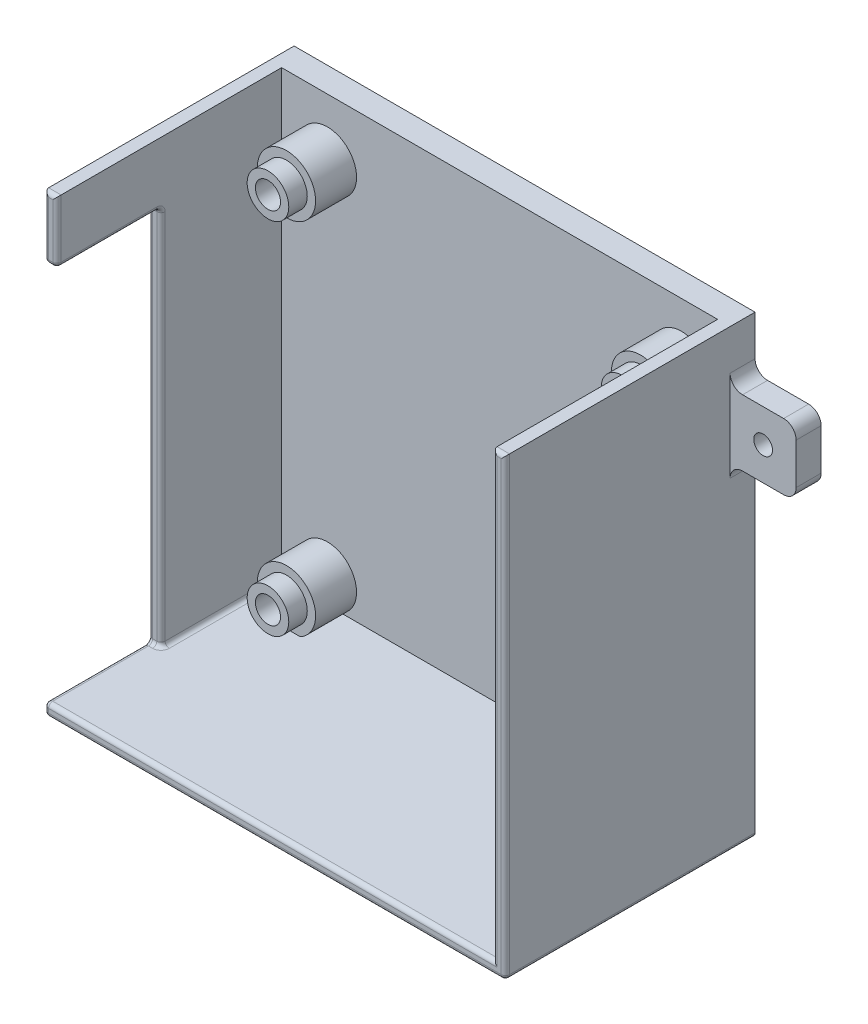
from build123d import *

# Parameters (mm, degrees)
SKETCH1_W            = 104.775
SKETCH1_H            = 106.3625
BOSS_EXTRUDE1_DEPTH  = 6
BOSS_EXTRUDE2_DEPTH  = 35
SKETCH3_R            = 5
SKETCH3_R_2          = 3.025
BOSS_EXTRUDE3_DEPTH  = 14.2875
SKETCH4_R            = 7
SKETCH4_R_2          = 3.025
BOSS_EXTRUDE4_DEPTH  = 9.8425
SKETCH6_W            = 15.875
SKETCH6_H            = 15.875
SKETCH6_W_2          = 15.88
SKETCH6_H_2          = 15.88
BOSS_EXTRUDE5_DEPTH  = 6
M4_CLEARANCE_HOLE1_D = 4.5
FILLET2_R            = 3
SKETCH9_W            = 3
SKETCH9_H            = 15
BOSS_EXTRUDE6_DEPTH  = 25
FILLET3_R            = 1


with BuildPart() as part:
    # Sketch1 → Boss-Extrude1 (new body)
    with BuildSketch(Plane.XY):
        Rectangle(SKETCH1_W, SKETCH1_H)
    extrude(amount=BOSS_EXTRUDE1_DEPTH)

    # Sketch2 → Boss-Extrude2 (add)
    with BuildSketch(Plane.XY):
        Polygon((-55.3875, -53.18125), (-55.3875, -56.18125), (-52.3875, -56.18125), (55.3875, -56.18125), (55.3875, 53.18125), (52.3875, 53.18125), (52.3875, -53.18125), (-52.3875, -53.18125), (-52.3875, 53.18125), (-55.3875, 53.18125), align=None)
    extrude(amount=BOSS_EXTRUDE2_DEPTH)

    # Sketch3 → Boss-Extrude3 (add)
    # profile 1 of 4: a face of its own
    with BuildSketch(Plane.XY.offset(6)):
        with Locations((43.708, 39.35095)):
            Circle(SKETCH3_R)
        with Locations((43.708, 39.35095)):
            Circle(SKETCH3_R_2, mode=Mode.SUBTRACT)
    # profile 2 of 4: a face of its own
    with BuildSketch(Plane.XY.offset(6)):
        with Locations((-41.382, 39.35095)):
            Circle(SKETCH3_R)
        with Locations((-41.382, 39.35095)):
            Circle(SKETCH3_R_2, mode=Mode.SUBTRACT)
    # profile 3 of 4: a face of its own
    with BuildSketch(Plane.XY.offset(6)):
        with Locations((-41.382, -47.00905)):
            Circle(SKETCH3_R)
        with Locations((-41.382, -47.00905)):
            Circle(SKETCH3_R_2, mode=Mode.SUBTRACT)
    # profile 4 of 4: a face of its own
    with BuildSketch(Plane.XY.offset(6)):
        with Locations((43.708, -47.00905)):
            Circle(SKETCH3_R)
        with Locations((43.708, -47.00905)):
            Circle(SKETCH3_R_2, mode=Mode.SUBTRACT)
    extrude(amount=BOSS_EXTRUDE3_DEPTH)

    # Sketch4 → Boss-Extrude4 (add)
    # profile 1 of 4: a face of its own
    with BuildSketch(Plane.XY.offset(6)):
        with Locations((43.708, 39.35095)):
            Circle(SKETCH4_R)
        with Locations((43.708, 39.35095)):
            Circle(SKETCH4_R_2, mode=Mode.SUBTRACT)
    # profile 2 of 4: a face of its own
    with BuildSketch(Plane.XY.offset(6)):
        with Locations((-41.382, 39.35095)):
            Circle(SKETCH4_R)
        with Locations((-41.382, 39.35095)):
            Circle(SKETCH4_R_2, mode=Mode.SUBTRACT)
    # profile 3 of 4: a face of its own
    with BuildSketch(Plane.XY.offset(6)):
        with Locations((-41.382, -47.00905)):
            Circle(SKETCH4_R)
        with Locations((-41.382, -47.00905)):
            Circle(SKETCH4_R_2, mode=Mode.SUBTRACT)
    # profile 4 of 4: a face of its own
    with BuildSketch(Plane.XY.offset(6)):
        with Locations((43.708, -47.00905)):
            Circle(SKETCH4_R)
        with Locations((43.708, -47.00905)):
            Circle(SKETCH4_R_2, mode=Mode.SUBTRACT)
    extrude(amount=BOSS_EXTRUDE4_DEPTH)

    # Sketch6 → Boss-Extrude5 (add)
    with BuildSketch(Plane.XY):
        with Locations((63.325, 32.54375)):
            Rectangle(SKETCH6_W, SKETCH6_H)
        with Locations((-63.3275, -48.24125)):
            Rectangle(SKETCH6_W_2, SKETCH6_H_2)
    extrude(amount=BOSS_EXTRUDE5_DEPTH)

    # M4 Clearance Hole1 (through all)
    with Locations(Plane.XY.offset(6)):
        with Locations((63.325, 32.54375), (-63.3275, -48.24125)):
            Hole(M4_CLEARANCE_HOLE1_D / 2)

    # Fillet2
    fillet2_edges = [part.edges().sort_by_distance(p)[0] for p in [
        (71.2625, 24.60625, 3),
        (71.2625, 40.48125, 3),
        (55.3875, 40.48125, 3),
        (55.3875, 24.60625, 3),
        (-71.2675, -56.18125, 3),
        (-71.2675, -40.30125, 3),
    ]]
    fillet(fillet2_edges, radius=FILLET2_R)

    # Sketch9 → Boss-Extrude6 (add)
    with BuildSketch(Plane.XY.offset(35)):
        with Locations((-53.8875, 45.68125)):
            Rectangle(SKETCH9_W, SKETCH9_H)
        Polygon((52.3875, -53.18125), (-55.3875, -53.18125), (-55.3875, -56.18125), (55.3875, -56.18125), (55.3875, 53.18125), (52.3875, 53.18125), align=None)
    extrude(amount=BOSS_EXTRUDE6_DEPTH)

    # Fillet3
    fillet3_edges = [part.edges().sort_by_distance(p)[0] for p in [
        (-53.8875, -53.18125, 35),
        (55.3875, -56.18125, 30),
        (-55.3875, -7.5, 35),
        (-52.3875, -7.5, 35),
        (-52.3875, -53.18125, 20.5),
        (-55.3875, -56.18125, 33),
        (-52.3875, 38.18125, 47.5),
        (-55.3875, -53.18125, 47.5),
        (-55.3875, 38.18125, 47.5),
        (-53.8875, 38.18125, 35),
        (52.3875, 0, 60),
        (53.8875, 53.18125, 60),
        (55.3875, -1.5, 60),
        (0, -56.18125, 60),
        (-55.3875, -54.68125, 60),
        (-1.5, -53.18125, 60),
        (-55.3875, 45.68125, 60),
        (-53.8875, 53.18125, 60),
        (-52.3875, 45.68125, 60),
        (-53.8875, 38.18125, 60),
    ]]
    fillet(fillet3_edges, radius=FILLET3_R)


solid = part.part
